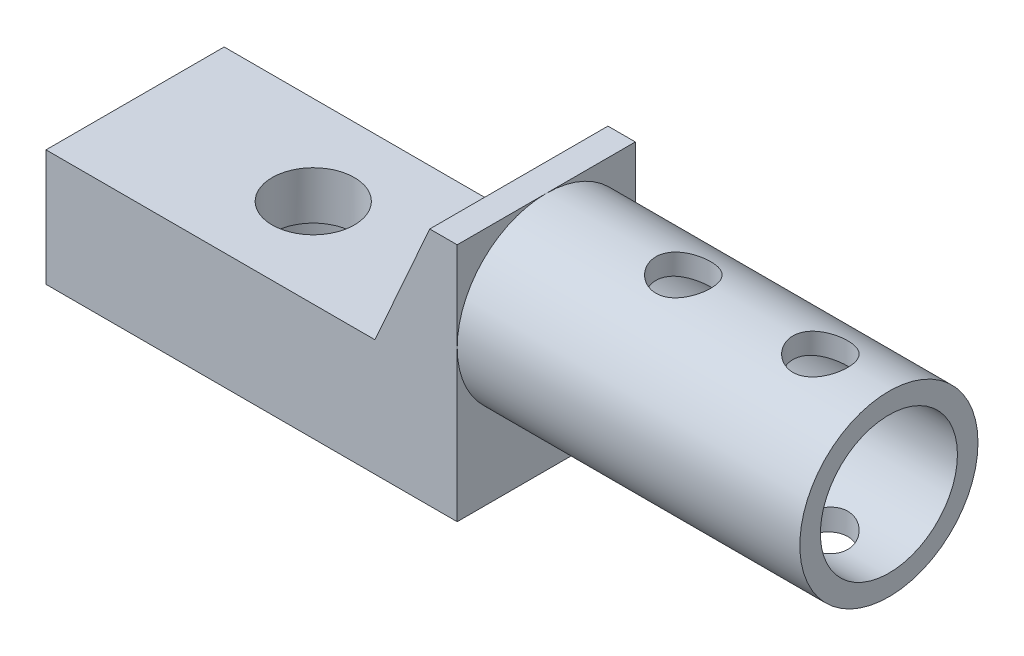
from build123d import *

# Parameters (mm, degrees)
SKETCH1_R               = 6.5
SKETCH1_R_2             = 5
BOSS_EXTRUDE1_DEPTH     = 25
BOSS_EXTRUDE2_DEPTH     = 2
CUT_EXTRUDE1_DEPTH      = 29.075790283
CUT_EXTRUDE1_DEPTH_BACK = 29.075790283
SKETCH4_R               = 2
SKETCH3_W               = 28
SKETCH3_H               = 13
SKETCH3_R               = 3
BOSS_EXTRUDE3_DEPTH     = 8.5
SKETCH5_R               = 5
CUT_EXTRUDE2_DEPTH      = 5
CHAMFER1_SIZE2          = 4
CHAMFER1_SIZE           = 9


with BuildPart() as part:
    # Sketch1 → Boss-Extrude1 (new body)
    with BuildSketch(Plane(origin=(0, 0, 0), x_dir=(0, 0, -1), z_dir=(1, 0, 0))):
        Circle(SKETCH1_R)
        Circle(SKETCH1_R_2, mode=Mode.SUBTRACT)
    extrude(amount=BOSS_EXTRUDE1_DEPTH)

    # Sketch2 → Boss-Extrude2 (add)
    with BuildSketch(Plane(origin=(0, 0, 0), x_dir=(0, 0, -1), z_dir=(1, 0, 0))):
        Polygon((-6.5, -6.5), (-6.5, -11), (6.5, -11), (6.5, -6.5), (6.5, 6.5), (-6.5, 6.5), align=None)
    extrude(amount=-BOSS_EXTRUDE2_DEPTH)

    # Sketch4 → Cut-Extrude1 (cut, two sides: drawn at the far end of the back side and taken through both)
    with BuildSketch(Plane(origin=(0, 0, 0), x_dir=(1, 0, 0), z_dir=(0, 1, 0)).offset(-CUT_EXTRUDE1_DEPTH_BACK)):
        with Locations(Location((10, 0, 0), (0, 0, 270))):
            Circle(SKETCH4_R)
        with Locations(Location((20, 0, 0), (0, 0, 270))):
            Circle(SKETCH4_R)
    extrude(amount=CUT_EXTRUDE1_DEPTH + CUT_EXTRUDE1_DEPTH_BACK, mode=Mode.SUBTRACT)

    # Sketch3 → Boss-Extrude3 (add)
    with BuildSketch(Plane(origin=(0, -2.5, 0), x_dir=(1, 0, 0), z_dir=(0, 1, 0))):
        with Locations((-16, 0)):
            Rectangle(SKETCH3_W, SKETCH3_H)
        with Locations(Location((-17, 0, 0), (0, 0, 270))):
            Circle(SKETCH3_R, mode=Mode.SUBTRACT)
    extrude(amount=-BOSS_EXTRUDE3_DEPTH)

    # Sketch5 → Cut-Extrude2 (cut)
    with BuildSketch(Plane.XZ.offset(11)):
        with Locations(Location((-17, 0, 0), (0, 0, 270))):
            Circle(SKETCH5_R)
    extrude(amount=-CUT_EXTRUDE2_DEPTH, mode=Mode.SUBTRACT)

    # Chamfer1
    chamfer1_edges = [part.edges().sort_by_distance(p)[0] for p in [
        (-2, -2.5, 0),
    ]]
    chamfer1_side = [part.faces().sort_by_distance(p)[0] for p in [
        (-2, -2.42, 0),
    ]]
    chamfer(chamfer1_edges, length=CHAMFER1_SIZE - 0.0001, length2=CHAMFER1_SIZE2 - 0.0001, reference=chamfer1_side[0])  # a hair under: the kernel refuses the full size


solid = part.part
